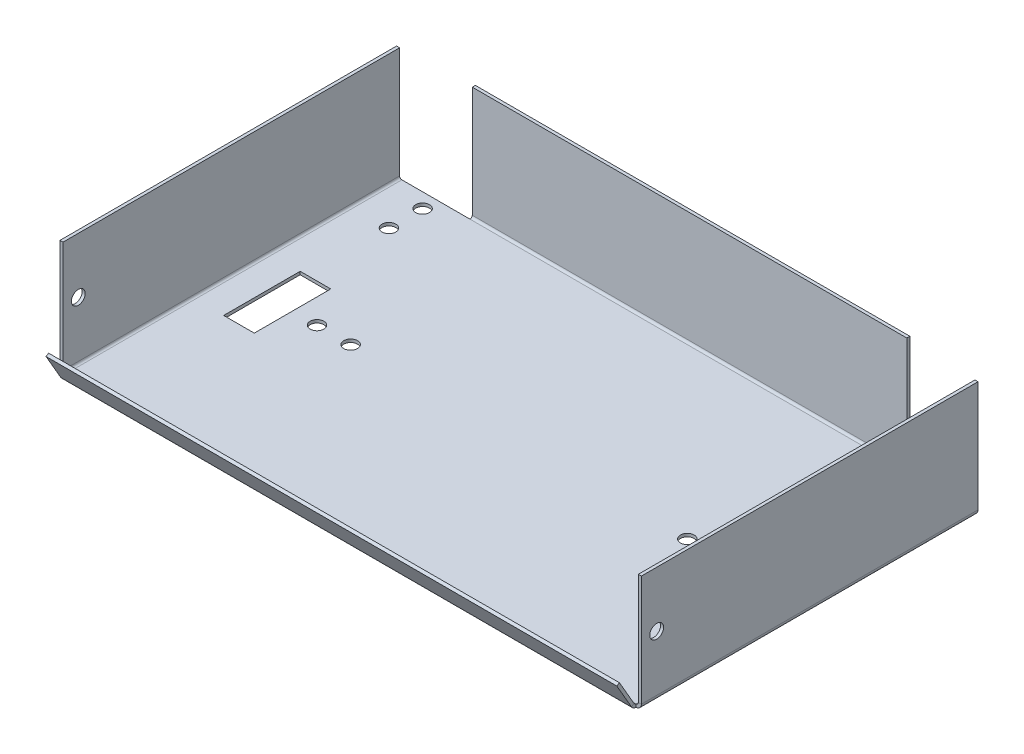
from build123d import *

# Parameters (mm, degrees)
SKETCH2_W                    = 190
SKETCH2_H                    = 110
BASE_FLANGE1_DEPTH           = 1
EDGE_FLANGE1_STRIP_W         = 5.4732
EDGE_FLANGE1_STRIP_H         = 1
EDGE_FLANGE1_STRIP_CUT_DEPTH = 110
EDGE_FLANGE1_DEPTH           = 110
SKETCH16_R                   = 2.25
CUT_EXTRUDE1_DEPTH           = 117.163677628
SKETCH17_W                   = 10
SKETCH17_H                   = 25
CUT_EXTRUDE2_DEPTH           = 117.163677628
EDGE_FLANGE2_DEPTH           = 142
EDGE_FLANGE3_DEPTH           = 186.5268
SKETCH29_R                   = 2.25
CUT_EXTRUDE3_DEPTH           = 204.225548722
SKETCH30_R                   = 2.25
CUT_EXTRUDE4_DEPTH           = 120.271218881


# Sheet-metal steps are written as plain solids
with BuildPart() as part:
    # Sketch2 → Base-Flange1 (new body)
    with BuildSketch(Plane(origin=(0, 0, 0), x_dir=(1, 0, 0), z_dir=(0, 1, 0))):
        Rectangle(SKETCH2_W, SKETCH2_H)
    extrude(amount=BASE_FLANGE1_DEPTH)

    # Edge-Flange1 strip (across the edge) → Edge-Flange1 strip cut (cut)
    with BuildSketch(Plane(origin=(95, 1, 55), x_dir=(-1, 0, 0), z_dir=(0, 0, -1))):
        with Locations((-1, -0.5)):
            Rectangle(EDGE_FLANGE1_STRIP_W, EDGE_FLANGE1_STRIP_H)
    edge_flange1_strip_cut = extrude(amount=EDGE_FLANGE1_STRIP_CUT_DEPTH, mode=Mode.SUBTRACT)

    # Edge-Flange1 section (across the edge) → Edge-Flange1 (add)
    with BuildSketch(Plane(origin=(95, 1, 55), x_dir=(-1, 0, 0), z_dir=(0, 0, -1))):
        with BuildLine():
            Line((0, 0.7366), (0, 37))
            Line((0, 37), (1, 37))
            Line((1, 37), (1, 0.7366))
            ThreePointArc((1, 0.7366), (1.215745145, 0.215745145), (1.7366, 0))
            Line((1.7366, 0), (1.7366, -1))
            ThreePointArc((1.7366, -1), (0.508638364, -0.491361636), (0, 0.7366))
        make_face()
    edge_flange1 = extrude(amount=EDGE_FLANGE1_DEPTH)

    # Mirror1: Edge-Flange1 strip cut, Edge-Flange1 across plane
    add(edge_flange1_strip_cut.mirror(Plane(origin=(0, 0, 0), x_dir=(0, 0, 1), z_dir=(1, 0, 0))), mode=Mode.SUBTRACT)
    add(edge_flange1.mirror(Plane(origin=(0, 0, 0), x_dir=(0, 0, 1), z_dir=(1, 0, 0))))

    # Sketch16 → Cut-Extrude1 (cut, through all)
    with BuildSketch(Plane.XZ):
        with Locations(Location((-55, 0, 0), (0, 0, 270))):
            Circle(SKETCH16_R)
        with Locations(Location((55, 0, 0), (0, 0, 270))):
            Circle(SKETCH16_R)
        with Locations(Location((66, 0, 0), (0, 0, 270))):
            Circle(SKETCH16_R)
        with Locations(Location((-66, 0, 0), (0, 0, 270))):
            Circle(SKETCH16_R)
    extrude(amount=-CUT_EXTRUDE1_DEPTH, mode=Mode.SUBTRACT)

    # Sketch17 → Cut-Extrude2 (cut, through all)
    with BuildSketch(Plane.XZ):
        with Locations((-79, 0)):
            Rectangle(SKETCH17_W, SKETCH17_H)
    cut_extrude2 = extrude(amount=-CUT_EXTRUDE2_DEPTH, mode=Mode.SUBTRACT)

    # Mirror2: Cut-Extrude2 across plane
    add(cut_extrude2.mirror(Plane(origin=(0, 0, 0), x_dir=(0, 0, 1), z_dir=(1, 0, 0))), mode=Mode.SUBTRACT)

    # Edge-Flange2 section (across the edge) → Edge-Flange2 (add)
    with BuildSketch(Plane(origin=(71, 1, -55.7366), x_dir=(0, 0, 1), z_dir=(-1, 0, 0))):
        with BuildLine():
            Line((-1, 0.7366), (-1, 37))
            Line((-1, 37), (0, 37))
            Line((0, 37), (0, 0.7366))
            ThreePointArc((0, 0.7366), (0.215745145, 0.215745145), (0.7366, 0))
            Line((0.7366, 0), (0.7366, -1))
            ThreePointArc((0.7366, -1), (-0.491361636, -0.491361636), (-1, 0.7366))
        make_face()
    extrude(amount=EDGE_FLANGE2_DEPTH)

    # Edge-Flange3 section (across the edge) → Edge-Flange3 (add)
    with BuildSketch(Plane(origin=(-93.2634, 1, 55.425276208), x_dir=(0, 0.5000000000000041, -0.8660254037844364), z_dir=(1, 0, 0))):
        with BuildLine():
            Line((-1, 0.425276208), (-1, 10))
            Line((-1, 10), (0, 10))
            Line((0, 10), (0, 0.425276208))
            ThreePointArc((0, 0.425276208), (0.098685688, 0.056976208), (0.3683, -0.212638104))
            Line((0.3683, -0.212638104), (-0.1317, -1.078663508))
            ThreePointArc((-0.1317, -1.078663508), (-0.767339716, -0.443023792), (-1, 0.425276208))
        make_face()
    extrude(amount=EDGE_FLANGE3_DEPTH)

    # Sketch29 → Cut-Extrude3 (cut, through all)
    with BuildSketch(Plane.ZY.offset(95)):
        with Locations(Location((50, 19.8683, 0), (0, 0, 270))):
            Circle(SKETCH29_R)
    extrude(amount=-CUT_EXTRUDE3_DEPTH, mode=Mode.SUBTRACT)

    # Sketch30 → Cut-Extrude4 (cut, through all)
    with BuildSketch(Plane.XZ):
        with Locations(Location((81.73, -39.2366, 0), (0, 0, 270))):
            Circle(SKETCH30_R)
        with Locations(Location((81.73, -50.2366, 0), (0, 0, 270))):
            Circle(SKETCH30_R)
        with Locations(Location((-81.73, -39.2366, 0), (0, 0, 270))):
            Circle(SKETCH30_R)
        with Locations(Location((-81.73, -50.2366, 0), (0, 0, 270))):
            Circle(SKETCH30_R)
    extrude(amount=-CUT_EXTRUDE4_DEPTH, mode=Mode.SUBTRACT)


solid = part.part
